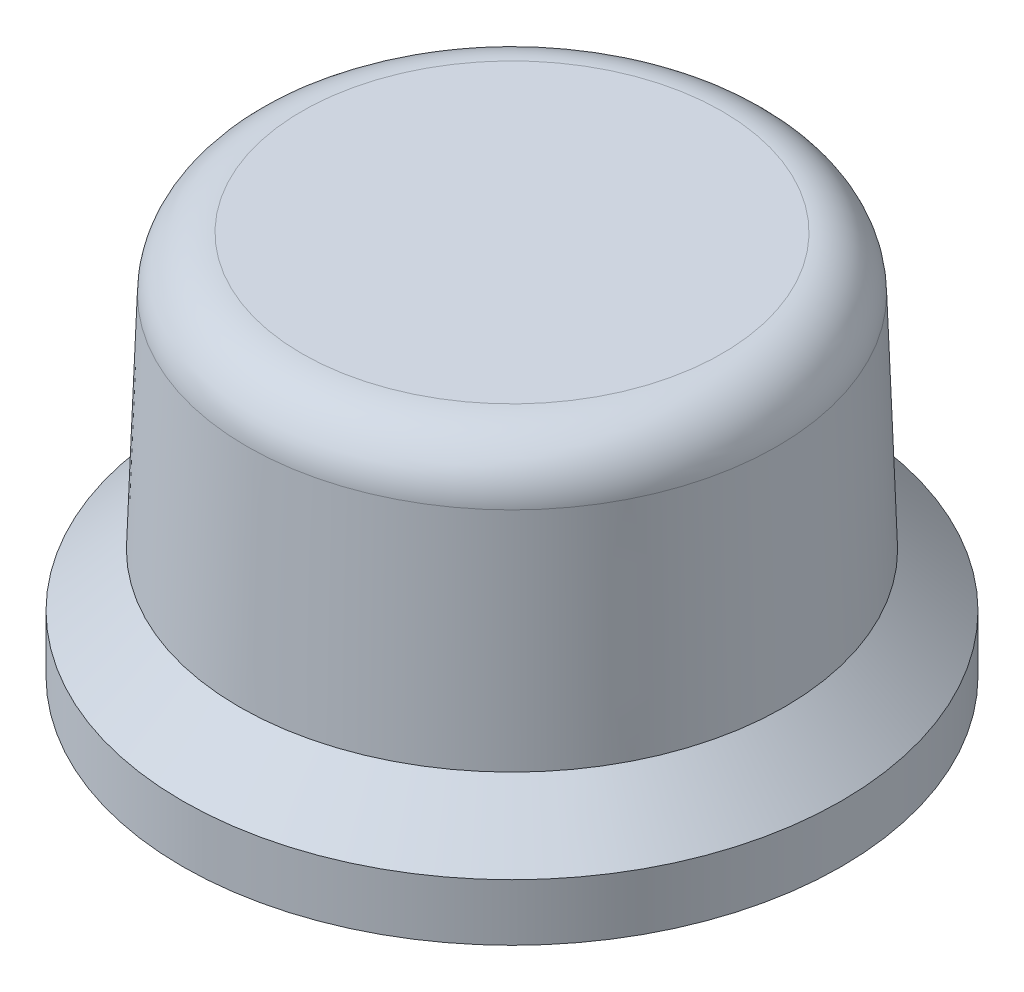
from build123d import *

# Parameters (mm, degrees)
SKETCH2_R               = 6
BOSS_EXTRUDE2_DEPTH     = 1
FILLET1_R               = 1
SKETCH3_R               = 2.5
SKETCH3_R_2             = 2
CUT_EXTRUDE1_DEPTH      = 1
BOSS_EXTRUDE3_START     = -3.5
BOSS_EXTRUDE3_OUTLINE_R = 1.5
BOSS_EXTRUDE3_DEPTH     = 2.5
FILLET2_R               = 0.25
FILLET3_R               = 0.25
CHAMFER1_SIZE           = 1.036815955
CHAMFER1_SIZE_2         = 1


# Read off the part's stored shape, not the designer's step: Boss-Extrude1, Boss-Extrude3
# Some blends are built 0.0001 mm under size
with BuildPart() as part:
    # Boss-Extrude1 outline → Boss-Extrude1 (revolve)
    with BuildSketch(Plane.XY):
        Polygon((5, 0), (4.790475383, 6), (0, 6), (0, 0), align=None)
    revolve(axis=Axis((0, 0, 0), (0, 1, 0)))

    # Sketch2 (on Top Plane) → Boss-Extrude2 (add)
    with BuildSketch(Plane(origin=(0, 0, 0), x_dir=(1, 0, 0), z_dir=(0, 1, 0))):
        with Locations(Location((0, 0, 0), (0, 0, 90))):
            Circle(SKETCH2_R)
    extrude(amount=-BOSS_EXTRUDE2_DEPTH)

    # Fillet1
    fillet1_edges = [part.edges().sort_by_distance(p)[0] for p in [
        (-4.790475383, 6, 0),
    ]]
    fillet(fillet1_edges, radius=FILLET1_R)

    # Sketch3 (on Top Plane) → Cut-Extrude1 (cut)
    with BuildSketch(Plane(origin=(0, 0, 0), x_dir=(1, 0, 0), z_dir=(0, 1, 0))):
        with Locations(Location((0, 0, 0), (0, 0, 90))):
            Circle(SKETCH3_R)
        with Locations(Location((0, 0, 0), (0, 0, 90))):
            Circle(SKETCH3_R_2, mode=Mode.SUBTRACT)
    extrude(amount=-CUT_EXTRUDE1_DEPTH, mode=Mode.SUBTRACT)

    # Boss-Extrude3 outline → Boss-Extrude3 (add)
    with BuildSketch(Plane(origin=(0, 0, 0), x_dir=(1, 0, 0), z_dir=(0, 1, 0)).offset(BOSS_EXTRUDE3_START)):
        Circle(BOSS_EXTRUDE3_OUTLINE_R)
    extrude(amount=BOSS_EXTRUDE3_DEPTH)

    # Fillet2
    fillet2_edges = [part.edges().sort_by_distance(p)[0] for p in [
        (0, -1, 2.5),
        (0, -1, 2),
        (-1.5, -1, 0),
    ]]
    fillet(fillet2_edges, radius=FILLET2_R - 0.0001)  # a hair under: the kernel refuses the full size

    # Fillet3
    fillet3_edges = [part.edges().sort_by_distance(p)[0] for p in [
        (-1.5, -3.5, 0),
    ]]
    fillet(fillet3_edges, radius=FILLET3_R)

    # Chamfer1
    # the kernel refuses this chamfer: 1.036815955, 1 mm, written as the material it adds along each edge
    with BuildSketch(Plane(origin=(0, 0, 0), x_dir=(1, 0, 0), z_dir=(0, 0, 1))) as chamfer1_piece_1_section:
        Polygon((5 + CHAMFER1_SIZE, 0), (5 - CHAMFER1_SIZE_2 * 0.0348994967107, CHAMFER1_SIZE_2 * 0.999390827019), (5, 0), align=None)
    chamfer1_piece_1 = revolve(axis=Axis((0, 0, 0), (0, 1, 0)), mode=Mode.PRIVATE)
    chamfer1_piece_1 = chamfer1_piece_1 & Plane(origin=(0, 0.511488324, 0), x_dir=(0, 0, -1), z_dir=(0, 1, 0)) * Cylinder(6, 25, mode=Mode.PRIVATE)
    add(chamfer1_piece_1)


solid = part.part
